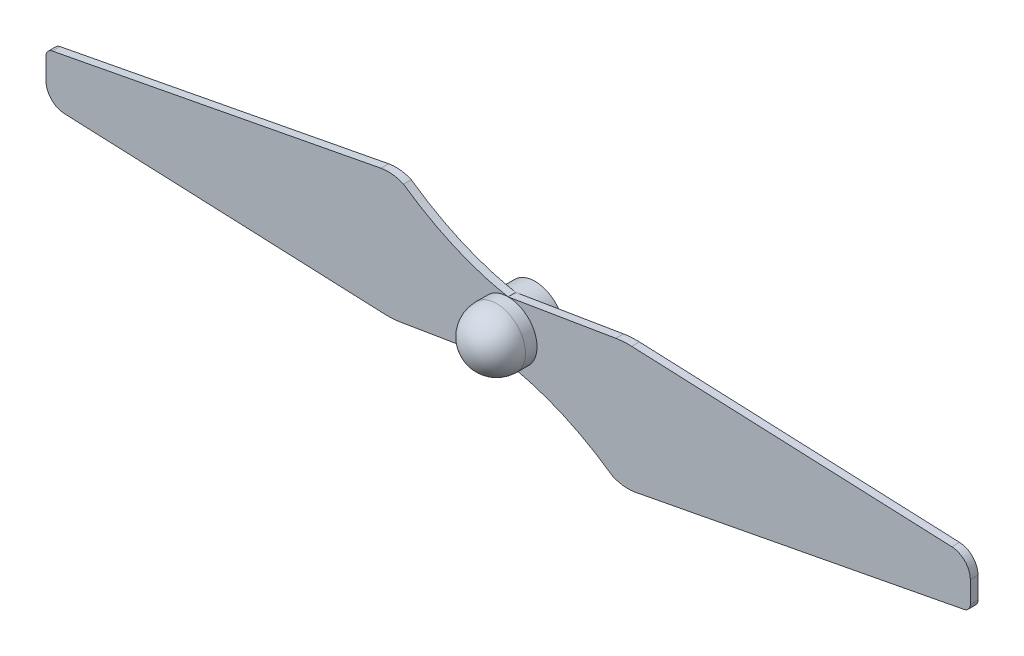
from build123d import *
from build123d.topology import SkipClean

# Parameters (mm, degrees)
SKETCH_1_R          = 7.5
EXTRUDE_1_DEPTH     = 10
SKETCH_5_R          = 2.5
CUT_EXTRUDE_1_DEPTH = 14
EXTRUDE_2_DEPTH     = 2
SKETCH_8_R          = 2.5
CUT_EXTRUDE_2_DEPTH = 12


with BuildPart() as part:
    # 스케치1 → 보스-돌출1 (new body)
    with BuildSketch(Plane.XY):
        Circle(SKETCH_1_R)
    extrude(amount=EXTRUDE_1_DEPTH)

    # 스케치4 → 회전4 (revolve)
    with SkipClean():  # the faces are left unmerged after this step: merging them gives an invalid solid
        with BuildSketch(Plane(origin=(0, 0, 0), x_dir=(0, -1, 0), z_dir=(-1, 0, 0))):
            with BuildLine():
                ThreePointArc((7.5, 10), (0, 17.5), (-7.5, 10))
                Line((-7.5, 10), (7.5, 10))
            make_face()
        revolve(axis=Axis((0, 7.5, 10), (0, -1, 0)))

    # 스케치5 → 컷-돌출1 (cut)
    with SkipClean():  # the faces are left unmerged after this step: merging them gives an invalid solid
        with BuildSketch(Plane(origin=(0, 0, 0), x_dir=(-1, 0, 0), z_dir=(0, 0, -1))):
            Circle(SKETCH_5_R)
        extrude(amount=-CUT_EXTRUDE_1_DEPTH, mode=Mode.SUBTRACT)

    # 스케치7 → 보스-돌출2 (add)
    with BuildSketch(Plane(origin=(0, 0, 5), x_dir=(-1, 0, 0), z_dir=(0, 0, -1))):
        with BuildLine():
            Line((120, -3.91423134), (120, -1.638169923))
            Line((120, -1.638169923), (120, 1.638169923))
            ThreePointArc((120, 1.638169923), (119.541296929, 2.912690922), (118.375596223, 3.602585224))
            Line((118.375596223, 3.602585224), (33.026639247, 19.921306549))
            ThreePointArc((33.026639247, 19.921306549), (30.05093506, 20.03879764), (27.172583756, 19.274786294))
            add(Edge.make_bspline(
                [(27.172583756, 19.274786294), (14.034416748, 10.081105305), (0, 7.5)],
                knots=[0, 0, 0, 1, 1, 1], degree=2))
            Line((0, 7.5), (-27.948278937, 12.158046489))
            ThreePointArc((-27.948278937, 12.158046489), (-30.006632076, 12.392332685), (-32.07817821, 12.412439443))
            Line((-32.07817821, 12.412439443), (-115.210479882, 8.909799198))
            ThreePointArc((-115.210479882, 8.909799198), (-118.609182692, 7.374549287), (-120, 3.91423134))
            Line((-120, 3.91423134), (-120, 1.638169923))
            Line((-120, 1.638169923), (-120, -1.638169923))
            ThreePointArc((-120, -1.638169923), (-119.541296929, -2.912690922), (-118.375596223, -3.602585224))
            Line((-118.375596223, -3.602585224), (-33.026639247, -19.921306549))
            ThreePointArc((-33.026639247, -19.921306549), (-30.05093506, -20.03879764), (-27.172583756, -19.274786294))
            add(Edge.make_bspline(
                [(-27.172583756, -19.274786294), (-14.034416748, -10.081105305), (0, -7.5)],
                knots=[0, 0, 0, 1, 1, 1], degree=2))
            Line((0, -7.5), (27.948278937, -12.158046489))
            ThreePointArc((27.948278937, -12.158046489), (30.006632076, -12.392332685), (32.07817821, -12.412439443))
            Line((32.07817821, -12.412439443), (115.210479882, -8.909799198))
            ThreePointArc((115.210479882, -8.909799198), (118.609182692, -7.374549287), (120, -3.91423134))
        make_face()
    extrude(amount=-EXTRUDE_2_DEPTH)

    # 스케치8 → 컷-돌출2 (cut)
    with BuildSketch(Plane(origin=(0, 0, 0), x_dir=(-1, 0, 0), z_dir=(0, 0, -1))):
        Circle(SKETCH_8_R)
    extrude(amount=-CUT_EXTRUDE_2_DEPTH, mode=Mode.SUBTRACT)


solid = part.part
